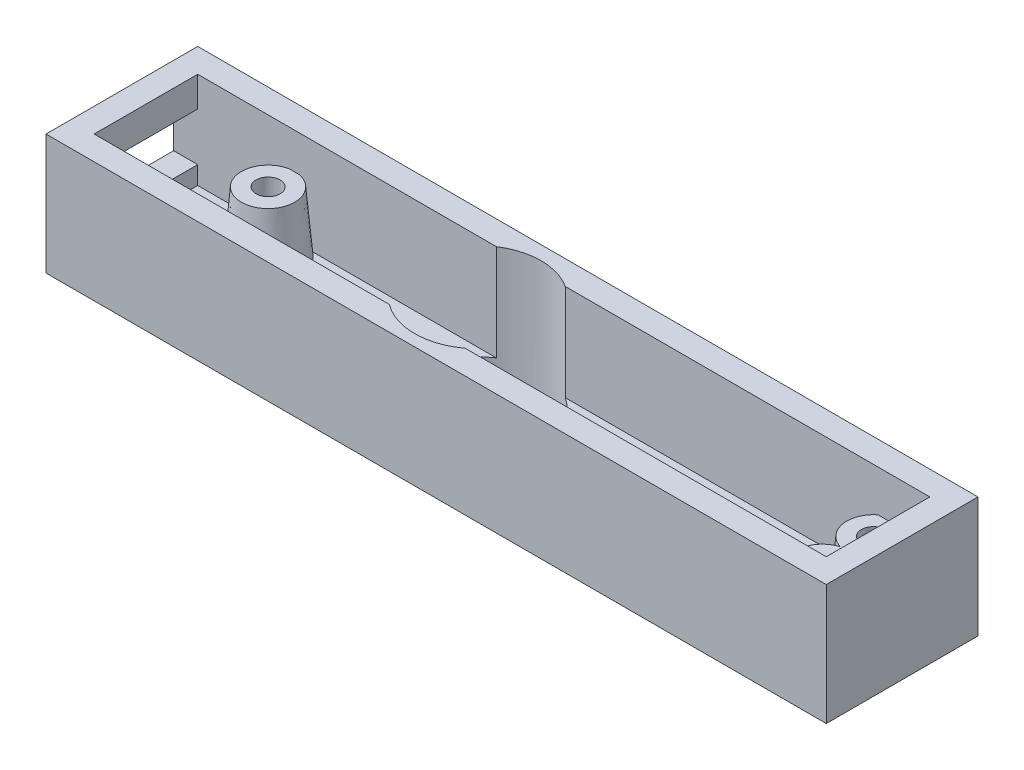
from build123d import *

# Parameters (mm, degrees)
SKETCH1_W                     = 64.8
SKETCH1_H                     = 12.6
BOSS_EXTRUDE1_DEPTH           = 2
SKETCH2_W                     = 64.8
SKETCH2_H                     = 12.6
SKETCH2_W_2                   = 60.8
SKETCH2_H_2                   = 8.6
BOSS_EXTRUDE2_DEPTH           = 8
SKETCH3_R                     = 5.25
CUT_EXTRUDE1_DEPTH            = 67.766758196
BOSS_EXTRUDE3_DEPTH           = 5
BOSS_EXTRUDE3_DRAFT           = 5
SKETCH4_R                     = 2.65
BOSS_EXTRUDE3_PROFILE_2_DEPTH = 5
BOSS_EXTRUDE3_PROFILE_2_DRAFT = 5
SKETCH5_R                     = 1
CUT_EXTRUDE2_DEPTH            = 4
SKETCH6_W                     = 8.6
SKETCH6_H                     = 4
CUT_EXTRUDE3_DEPTH            = 3


with BuildPart() as part:
    # Sketch1 → Boss-Extrude1 (new body)
    with BuildSketch(Plane(origin=(0, 0, 0), x_dir=(1, 0, 0), z_dir=(0, 1, 0))):
        with Locations((32.4, -6.3)):
            Rectangle(SKETCH1_W, SKETCH1_H)
    extrude(amount=BOSS_EXTRUDE1_DEPTH)

    # Sketch2 → Boss-Extrude2 (add)
    with BuildSketch(Plane(origin=(0, 2, 0), x_dir=(1, 0, 0), z_dir=(0, 1, 0))):
        with Locations((32.4, -6.3)):
            Rectangle(SKETCH2_W, SKETCH2_H)
        with Locations((32.4, -6.3)):
            Rectangle(SKETCH2_W_2, SKETCH2_H_2, mode=Mode.SUBTRACT)
    extrude(amount=BOSS_EXTRUDE2_DEPTH)

    # Sketch3 → Cut-Extrude1 (cut, through all)
    with BuildSketch(Plane(origin=(0, 0, 0), x_dir=(-1, 0, 0), z_dir=(0, -1, 0))):
        with Locations((-29.66, -6.4)):
            Circle(SKETCH3_R)
    extrude(amount=-CUT_EXTRUDE1_DEPTH, mode=Mode.SUBTRACT)


with BuildPart() as boss_extrude3_tool:
    # Sketch4 → Boss-Extrude3 (with draft: the straight prism first)
    with BuildSketch(Plane(origin=(0, 2, 0), x_dir=(1, 0, 0), z_dir=(0, 1, 0))):
        with BuildLine():
            Line((62.8, -5.058919792), (62.8, -3.301080208))
            ThreePointArc((62.8, -3.301080208), (62.406319968, -2.571921583), (61.806685103, -2))
            Line((61.806685103, -2), (58.793314897, -2))
            ThreePointArc((58.793314897, -2), (57.650497281, -4.128664408), (58.71, -6.3))
            ThreePointArc((58.71, -6.3), (57.650497281, -8.471335592), (58.793314897, -10.6))
            Line((58.793314897, -10.6), (61.806685103, -10.6))
            ThreePointArc((61.806685103, -10.6), (62.406319968, -10.028078417), (62.8, -9.298919792))
            Line((62.8, -9.298919792), (62.8, -7.541080208))
            ThreePointArc((62.8, -7.541080208), (62.437076279, -6.85302681), (61.89, -6.3))
            ThreePointArc((61.89, -6.3), (62.437076279, -5.74697319), (62.8, -5.058919792))
        make_face()
    extrude(amount=BOSS_EXTRUDE3_DEPTH)
    # Boss-Extrude3: the draft: its side faces are tilted about the plane it starts from
    boss_extrude3_sides = [boss_extrude3_tool.faces().sort_by_distance(p)[0] for p in [
        (60.3, 4.5, 10.6),
        (62.406319968, 4.5, 10.028078417),
        (62.8, 4.5, 8.42),
        (62.437076279, 4.5, 6.85302681),
        (62.437076279, 4.5, 5.74697319),
        (62.8, 4.5, 4.18),
        (62.406319968, 4.5, 2.571921583),
        (60.3, 4.5, 2),
        (57.650497281, 4.5, 4.128664408),
        (57.650497281, 4.5, 8.471335592),
    ]]
    draft(boss_extrude3_sides, Plane(origin=(0, 2, 0), x_dir=(1, 0, 0), z_dir=(0, 1, 0)), BOSS_EXTRUDE3_DRAFT)


with BuildPart() as part_1:
    add(part.part)

    # Boss-Extrude3: add boss_extrude3_tool
    add(boss_extrude3_tool.part)


with BuildPart() as boss_extrude3_profile_2_tool:
    # Sketch4 → Boss-Extrude3 profile 2 (with draft: the straight prism first)
    with BuildSketch(Plane(origin=(0, 2, 0), x_dir=(1, 0, 0), z_dir=(0, 1, 0))):
        with Locations((10.02, -4.18)):
            Circle(SKETCH4_R)
    extrude(amount=BOSS_EXTRUDE3_PROFILE_2_DEPTH)
    # Boss-Extrude3 profile 2: the draft: its side faces are tilted about the plane it starts from
    boss_extrude3_profile_2_sides = [boss_extrude3_profile_2_tool.faces().sort_by_distance(p)[0] for p in [
        (7.37, 4.5, 4.18),
    ]]
    draft(boss_extrude3_profile_2_sides, Plane(origin=(0, 2, 0), x_dir=(1, 0, 0), z_dir=(0, 1, 0)), BOSS_EXTRUDE3_PROFILE_2_DRAFT)


with BuildPart() as part_2:
    add(part_1.part)

    # Boss-Extrude3 profile 2: add boss_extrude3_profile_2_tool
    add(boss_extrude3_profile_2_tool.part)

    # Sketch5 → Cut-Extrude2 (cut)
    with BuildSketch(Plane(origin=(0, 7, 0), x_dir=(1, 0, 0), z_dir=(0, 1, 0))):
        with Locations((60.3, -8.42)):
            Circle(SKETCH5_R)
        with Locations((10.02, -4.18)):
            Circle(SKETCH5_R)
        with Locations((60.3, -4.18)):
            Circle(SKETCH5_R)
    extrude(amount=-CUT_EXTRUDE2_DEPTH, mode=Mode.SUBTRACT)

    # Sketch6 → Cut-Extrude3 (cut)
    with BuildSketch(Plane.ZY):
        with Locations((6.3, 5.5)):
            Rectangle(SKETCH6_W, SKETCH6_H)
    extrude(amount=-CUT_EXTRUDE3_DEPTH, mode=Mode.SUBTRACT)


solid = part_2.part
